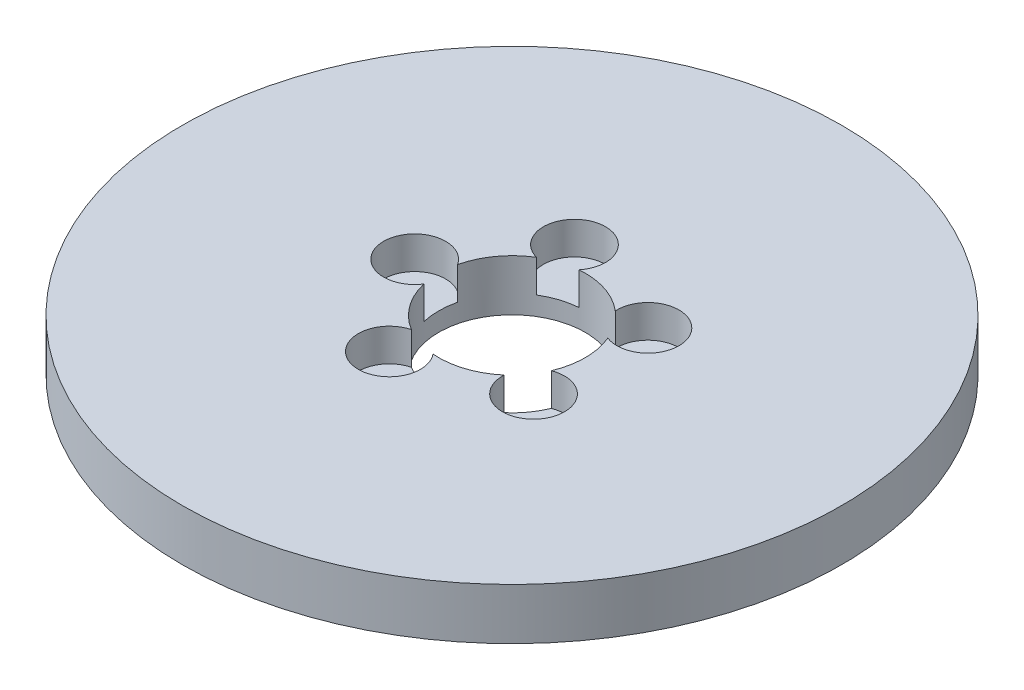
from build123d import *

# Parameters (mm, degrees)
SKETCH1_R           = 45
BOSS_EXTRUDE1_DEPTH = 7
SKETCH2_R           = 10
CUT_EXTRUDE1_DEPTH  = 65.02343321
SKETCH3_R           = 4.238184121
CUT_EXTRUDE2_DEPTH  = 4.455611112
CIRPATTERN1_COUNT   = 5


with BuildPart() as part:
    # Sketch1 → Boss-Extrude1 (new body)
    with BuildSketch(Plane(origin=(0, 0, 0), x_dir=(1, 0, 0), z_dir=(0, 1, 0))):
        Circle(SKETCH1_R)
    extrude(amount=BOSS_EXTRUDE1_DEPTH)

    # Sketch2 → Cut-Extrude1 (cut, through all)
    with BuildSketch(Plane(origin=(0, 0, 0), x_dir=(1, 0, 0), z_dir=(0, 1, 0))):
        Circle(SKETCH2_R)
    extrude(amount=CUT_EXTRUDE1_DEPTH, mode=Mode.SUBTRACT)

    # Sketch3 → Cut-Extrude2 (cut)
    with BuildSketch(Plane(origin=(0, 7, 0), x_dir=(1, 0, 0), z_dir=(0, 1, 0))):
        with Locations((-13.288593081, 0)):
            Circle(SKETCH3_R)
    cut_extrude2 = extrude(amount=-CUT_EXTRUDE2_DEPTH, mode=Mode.SUBTRACT)

    # CirPattern1: Cut-Extrude2 ×5 about axis
    cirpattern1_axis = Axis((0, 0, 0), (0, 1, 0))
    for i in range(1, CIRPATTERN1_COUNT):
        add(cut_extrude2.rotate(cirpattern1_axis, i * 360 / CIRPATTERN1_COUNT), mode=Mode.SUBTRACT)


solid = part.part
